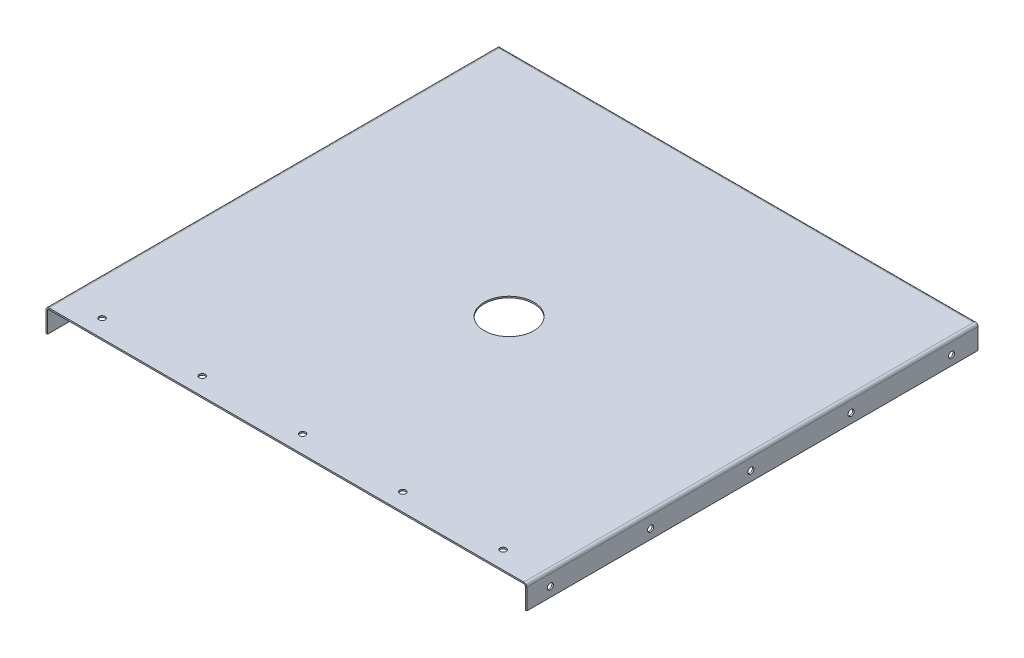
from build123d import *

# Parameters (mm, degrees)
SKETCH1_W                    = 514.4008
SKETCH1_H                    = 485.8004
BOSS_EXTRUDE1_DEPTH          = 1.6002
EDGE_FLANGE1_STRIP_W         = 9.6012
EDGE_FLANGE1_STRIP_H         = 1.6002
EDGE_FLANGE1_STRIP_CUT_DEPTH = 485.8004
EDGE_FLANGE1_DEPTH           = 485.8004
EDGE_FLANGE2_STRIP_W         = 9.6012
EDGE_FLANGE2_STRIP_H         = 1.6002
EDGE_FLANGE2_STRIP_CUT_DEPTH = 485.8004
EDGE_FLANGE2_DEPTH           = 485.8004
EDGE_FLANGE4_STRIP_W         = 9.6012
EDGE_FLANGE4_STRIP_H         = 1.6002
EDGE_FLANGE4_STRIP_CUT_DEPTH = 511.2004
EDGE_FLANGE4_DEPTH           = 511.2004
SKETCH18_R                   = 3.2639
CUT_EXTRUDE1_DEPTH           = 573.937935837
SKETCH19_R                   = 3.2639
CUT_EXTRUDE2_DEPTH           = 2.54
SKETCH20_R                   = 3.2639
CUT_EXTRUDE3_DEPTH           = 2.54
SKETCH21_R                   = 26.67
CUT_EXTRUDE4_DEPTH           = 357.936067329


# Sheet-metal steps are written as plain solids
with BuildPart() as part:
    # Sketch1 → Boss-Extrude1 (new body)
    with BuildSketch(Plane(origin=(0, 0, 0), x_dir=(1, 0, 0), z_dir=(0, 1, 0))):
        Rectangle(SKETCH1_W, SKETCH1_H)
    extrude(amount=BOSS_EXTRUDE1_DEPTH)

    # Edge-Flange1 strip (across the edge) → Edge-Flange1 strip cut (cut)
    with BuildSketch(Plane(origin=(-257.2004, 0, 242.9002), x_dir=(1, 0, 0), z_dir=(0, 0, -1))):
        with Locations((-3.2004, -0.8001)):
            Rectangle(EDGE_FLANGE1_STRIP_W, EDGE_FLANGE1_STRIP_H)
    extrude(amount=EDGE_FLANGE1_STRIP_CUT_DEPTH, mode=Mode.SUBTRACT)

    # Edge-Flange1 section (across the edge) → Edge-Flange1 (add)
    with BuildSketch(Plane(origin=(-257.2004, 0, 242.9002), x_dir=(1, 0, 0), z_dir=(0, 0, -1))):
        with BuildLine():
            Line((-1.6002, 1.6002), (-1.6002, 23.7998))
            Line((-1.6002, 23.7998), (0, 23.7998))
            Line((0, 23.7998), (0, 1.6002))
            ThreePointArc((0, 1.6002), (0.468687729, 0.468687729), (1.6002, 0))
            Line((1.6002, 0), (1.6002, -1.6002))
            ThreePointArc((1.6002, -1.6002), (-0.662824543, -0.662824543), (-1.6002, 1.6002))
        make_face()
    extrude(amount=EDGE_FLANGE1_DEPTH)

    # Edge-Flange2 strip (across the edge) → Edge-Flange2 strip cut (cut)
    with BuildSketch(Plane(origin=(257.2004, 0, -242.9002), x_dir=(-1, 0, 0), z_dir=(0, 0, 1))):
        with Locations((-3.2004, -0.8001)):
            Rectangle(EDGE_FLANGE2_STRIP_W, EDGE_FLANGE2_STRIP_H)
    extrude(amount=EDGE_FLANGE2_STRIP_CUT_DEPTH, mode=Mode.SUBTRACT)

    # Edge-Flange2 section (across the edge) → Edge-Flange2 (add)
    with BuildSketch(Plane(origin=(257.2004, 0, -242.9002), x_dir=(-1, 0, 0), z_dir=(0, 0, 1))):
        with BuildLine():
            Line((-1.6002, 1.6002), (-1.6002, 23.7998))
            Line((-1.6002, 23.7998), (0, 23.7998))
            Line((0, 23.7998), (0, 1.6002))
            ThreePointArc((0, 1.6002), (0.468687729, 0.468687729), (1.6002, 0))
            Line((1.6002, 0), (1.6002, -1.6002))
            ThreePointArc((1.6002, -1.6002), (-0.662824543, -0.662824543), (-1.6002, 1.6002))
        make_face()
    extrude(amount=EDGE_FLANGE2_DEPTH)

    # Edge-Flange4 strip (across the edge) → Edge-Flange4 strip cut (cut)
    with BuildSketch(Plane(origin=(-255.6002, 0, -242.9002), x_dir=(0, 0, 1), z_dir=(1, 0, 0))):
        with Locations((-3.2004, -0.8001)):
            Rectangle(EDGE_FLANGE4_STRIP_W, EDGE_FLANGE4_STRIP_H)
    extrude(amount=EDGE_FLANGE4_STRIP_CUT_DEPTH, mode=Mode.SUBTRACT)

    # Edge-Flange4 section (across the edge) → Edge-Flange4 (add)
    with BuildSketch(Plane(origin=(-255.6002, 0, -242.9002), x_dir=(0, 0, 1), z_dir=(1, 0, 0))):
        with BuildLine():
            Line((-1.6002, 1.6002), (-1.6002, 23.7998))
            Line((-1.6002, 23.7998), (0, 23.7998))
            Line((0, 23.7998), (0, 1.6002))
            ThreePointArc((0, 1.6002), (0.468687729, 0.468687729), (1.6002, 0))
            Line((1.6002, 0), (1.6002, -1.6002))
            ThreePointArc((1.6002, -1.6002), (-0.662824543, -0.662824543), (-1.6002, 1.6002))
        make_face()
    extrude(amount=EDGE_FLANGE4_DEPTH)

    # Sketch18 → Cut-Extrude1 (cut, through all)
    with BuildSketch(Plane(origin=(258.8006, 0, 0), x_dir=(0, 0, -1), z_dir=(1, 0, 0))):
        with Locations(Location((-217.5002, -13.6398, 0), (0, 0, 90))):
            Circle(SKETCH18_R)
        with Locations(Location((-109.5502, -13.6398, 0), (0, 0, 90))):
            Circle(SKETCH18_R)
        with Locations(Location((-1.6002, -13.6398, 0), (0, 0, 90))):
            Circle(SKETCH18_R)
        with Locations(Location((106.3498, -13.6398, 0), (0, 0, 90))):
            Circle(SKETCH18_R)
        with Locations(Location((214.2998, -13.6398, 0), (0, 0, 90))):
            Circle(SKETCH18_R)
    extrude(amount=-CUT_EXTRUDE1_DEPTH, mode=Mode.SUBTRACT)

    # Sketch19 → Cut-Extrude2 (cut)
    with BuildSketch(Plane(origin=(0, 0, -244.5004), x_dir=(-1, 0, 0), z_dir=(0, 0, -1))):
        with Locations(Location((-217.5002, -13.6398, 0), (0, 0, 90))):
            Circle(SKETCH19_R)
        with Locations(Location((-109.5502, -13.6398, 0), (0, 0, 90))):
            Circle(SKETCH19_R)
        with Locations(Location((-1.6002, -13.6398, 0), (0, 0, 90))):
            Circle(SKETCH19_R)
        with Locations(Location((106.3498, -13.6398, 0), (0, 0, 90))):
            Circle(SKETCH19_R)
        with Locations(Location((214.2998, -13.6398, 0), (0, 0, 90))):
            Circle(SKETCH19_R)
    extrude(amount=-CUT_EXTRUDE2_DEPTH, mode=Mode.SUBTRACT)

    # Sketch20 → Cut-Extrude3 (cut)
    with BuildSketch(Plane(origin=(0, 1.6002, 0), x_dir=(1, 0, 0), z_dir=(0, 1, 0))):
        with Locations(Location((-217.5002, -223.8502, 0), (0, 0, 270))):
            Circle(SKETCH20_R)
        with Locations(Location((-109.5502, -223.8502, 0), (0, 0, 270))):
            Circle(SKETCH20_R)
        with Locations(Location((-1.6002, -223.8502, 0), (0, 0, 270))):
            Circle(SKETCH20_R)
        with Locations(Location((106.3498, -223.8502, 0), (0, 0, 270))):
            Circle(SKETCH20_R)
        with Locations(Location((214.2998, -223.8502, 0), (0, 0, 270))):
            Circle(SKETCH20_R)
    extrude(amount=-CUT_EXTRUDE3_DEPTH, mode=Mode.SUBTRACT)

    # Sketch21 → Cut-Extrude4 (cut, through all)
    with BuildSketch(Plane(origin=(0, 1.6002, 0), x_dir=(1, 0, 0), z_dir=(0, 1, 0))):
        with Locations(Location((0, -3.175, 0), (0, 0, 270))):
            Circle(SKETCH21_R)
    extrude(amount=-CUT_EXTRUDE4_DEPTH, mode=Mode.SUBTRACT)


solid = part.part
